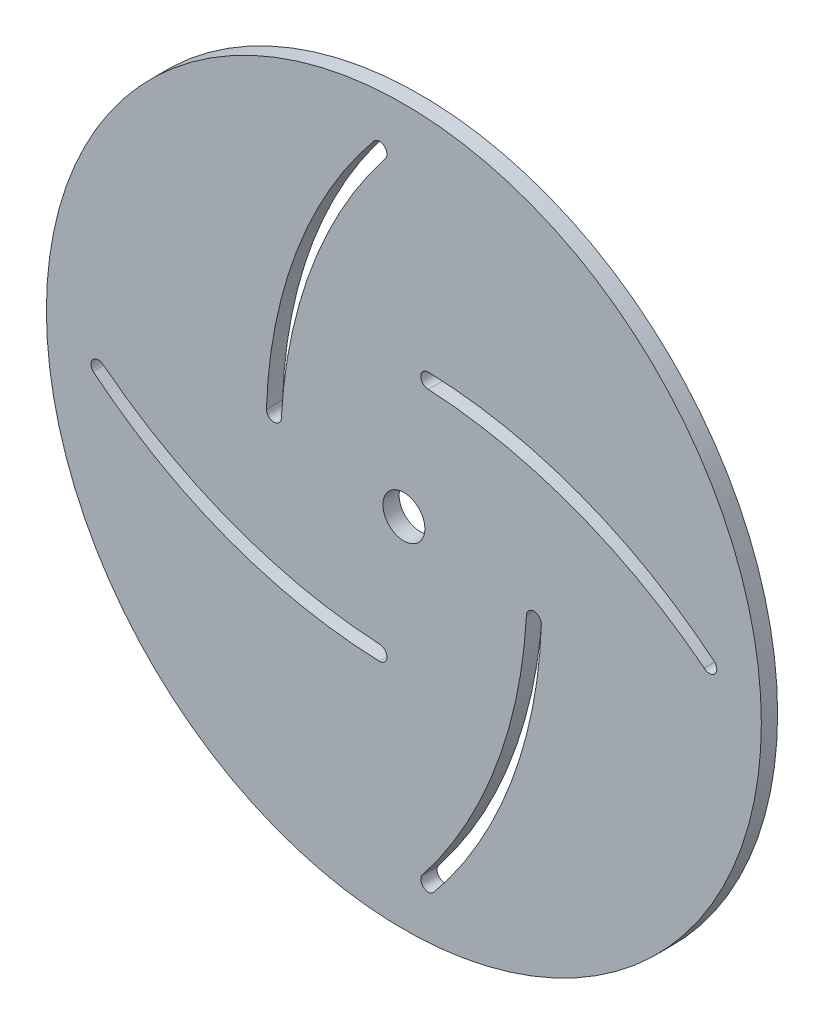
from build123d import *

# Parameters (mm, degrees)
SKETCH1_R           = 69.85
SKETCH1_R_2         = 4.1
BOSS_EXTRUDE1_DEPTH = 3.175


with BuildPart() as part:
    # Sketch1 → Boss-Extrude1 (new body)
    with BuildSketch(Plane.XY):
        Circle(SKETCH1_R)
        Circle(SKETCH1_R_2, mode=Mode.SUBTRACT)
        with BuildLine():
            ThreePointArc((60.715904818, 5.788404818), (34.486591453, 20.94201271), (4.777601385, 26.856792578))
            ThreePointArc((4.777601385, 26.856792578), (3.305570957, 25.407474231), (4.762499202, 23.942975224))
            ThreePointArc((4.762499202, 23.942975224), (33.266012569, 17.981736248), (58.664095182, 3.736595182))
            ThreePointArc((58.664095182, 3.736595182), (60.715904818, 3.736595182), (60.715904818, 5.788404818))
        make_face(mode=Mode.SUBTRACT)
        with BuildLine():
            ThreePointArc((-23.942975224, 4.762499202), (-17.981736248, 33.266012569), (-3.736595182, 58.664095182))
            ThreePointArc((-3.736595182, 58.664095182), (-3.736595182, 60.715904818), (-5.788404818, 60.715904818))
            ThreePointArc((-5.788404818, 60.715904818), (-20.94201271, 34.486591453), (-26.856792578, 4.777601385))
            ThreePointArc((-26.856792578, 4.777601385), (-25.407474231, 3.305570957), (-23.942975224, 4.762499202))
        make_face(mode=Mode.SUBTRACT)
        with BuildLine():
            ThreePointArc((5.788404818, -60.715904818), (20.94201271, -34.486591453), (26.856792578, -4.777601385))
            ThreePointArc((26.856792578, -4.777601385), (25.407474231, -3.305570957), (23.942975224, -4.762499202))
            ThreePointArc((23.942975224, -4.762499202), (17.981736248, -33.266012569), (3.736595182, -58.664095182))
            ThreePointArc((3.736595182, -58.664095182), (3.736595182, -60.715904818), (5.788404818, -60.715904818))
        make_face(mode=Mode.SUBTRACT)
        with BuildLine():
            ThreePointArc((-60.715904818, -5.788404818), (-34.486591453, -20.94201271), (-4.777601385, -26.856792578))
            ThreePointArc((-4.777601385, -26.856792578), (-3.305570957, -25.407474231), (-4.762499202, -23.942975224))
            ThreePointArc((-4.762499202, -23.942975224), (-33.266012569, -17.981736248), (-58.664095182, -3.736595182))
            ThreePointArc((-58.664095182, -3.736595182), (-60.715904818, -3.736595182), (-60.715904818, -5.788404818))
        make_face(mode=Mode.SUBTRACT)
    extrude(amount=BOSS_EXTRUDE1_DEPTH)


solid = part.part
